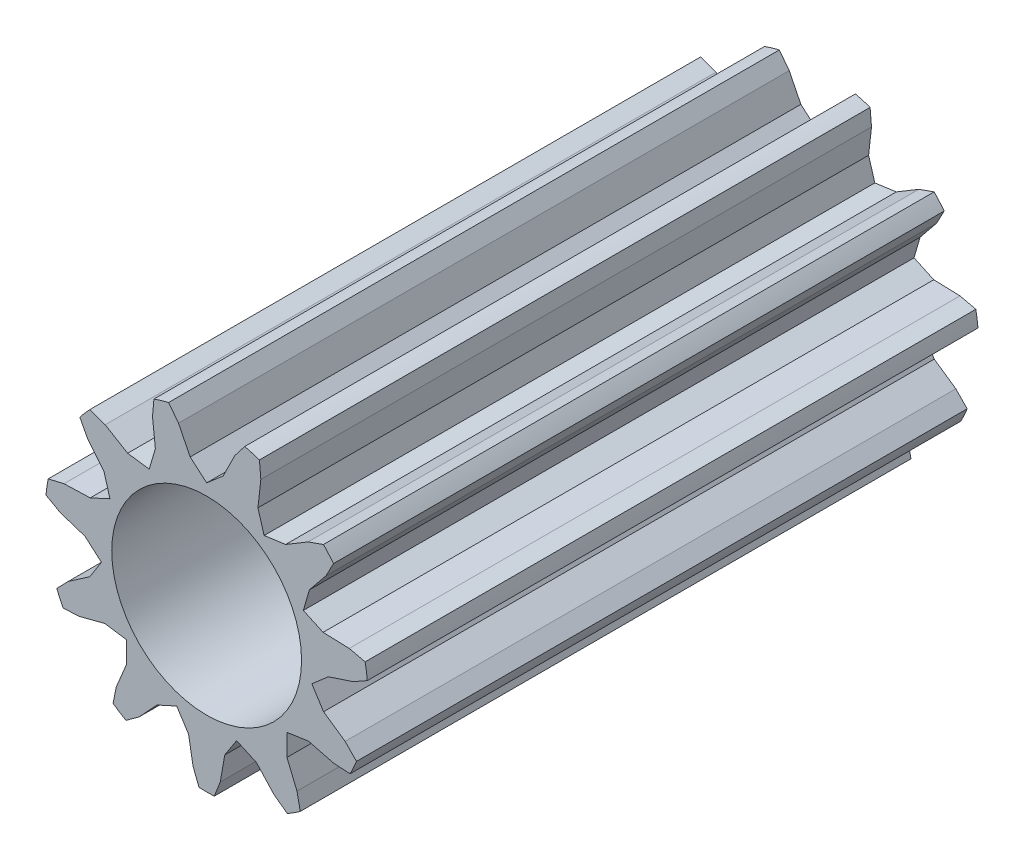
from build123d import *

# Parameters (mm, degrees)
SKETCH1_R               = 9.7778
BOSS_EXTRUDE1_DEPTH     = 37
CUT_EXTRUDE1_DEPTH      = 40.499503107
CUT_EXTRUDE2_DEPTH      = 40.499503107
CUT_EXTRUDE2_DEPTH_BACK = 40.499503107
SKETCH4_R               = 5.75
CIRPATTERN1_COUNT       = 11


with BuildPart() as part:
    # Sketch1 → Boss-Extrude1 (new body)
    with BuildSketch(Plane.XY):
        Circle(SKETCH1_R)
    extrude(amount=BOSS_EXTRUDE1_DEPTH)

    # Sketch2 → Cut-Extrude1 (cut, through all)
    with BuildSketch(Plane.XY):
        Polygon((0, 6.440231992), (-0.998470792, 7.29965938), (-1.704297747, 8.720724317), (-2.306603416, 9.501839481), (-1.704297747, 10.285038999), (0, 10.999278518), (1.704297747, 10.285038999), (2.306603416, 9.501839481), (1.704297747, 8.720724317), (0.998470792, 7.29965938), align=None)
    cut_extrude1 = extrude(amount=CUT_EXTRUDE1_DEPTH, mode=Mode.SUBTRACT)

    # Sketch4 → Cut-Extrude2 (cut, two sides: drawn at the far end of the back side and taken through both)
    with BuildSketch(Plane.XY.offset(37).offset(-CUT_EXTRUDE2_DEPTH_BACK)):
        Circle(SKETCH4_R)
    extrude(amount=CUT_EXTRUDE2_DEPTH + CUT_EXTRUDE2_DEPTH_BACK, mode=Mode.SUBTRACT)

    # CirPattern1: Cut-Extrude1 ×11 about axis
    cirpattern1_axis = Axis((0, 0, 37), (0, 0, -1))
    for i in range(1, CIRPATTERN1_COUNT):
        add(cut_extrude1.rotate(cirpattern1_axis, i * 360 / CIRPATTERN1_COUNT), mode=Mode.SUBTRACT)


solid = part.part
